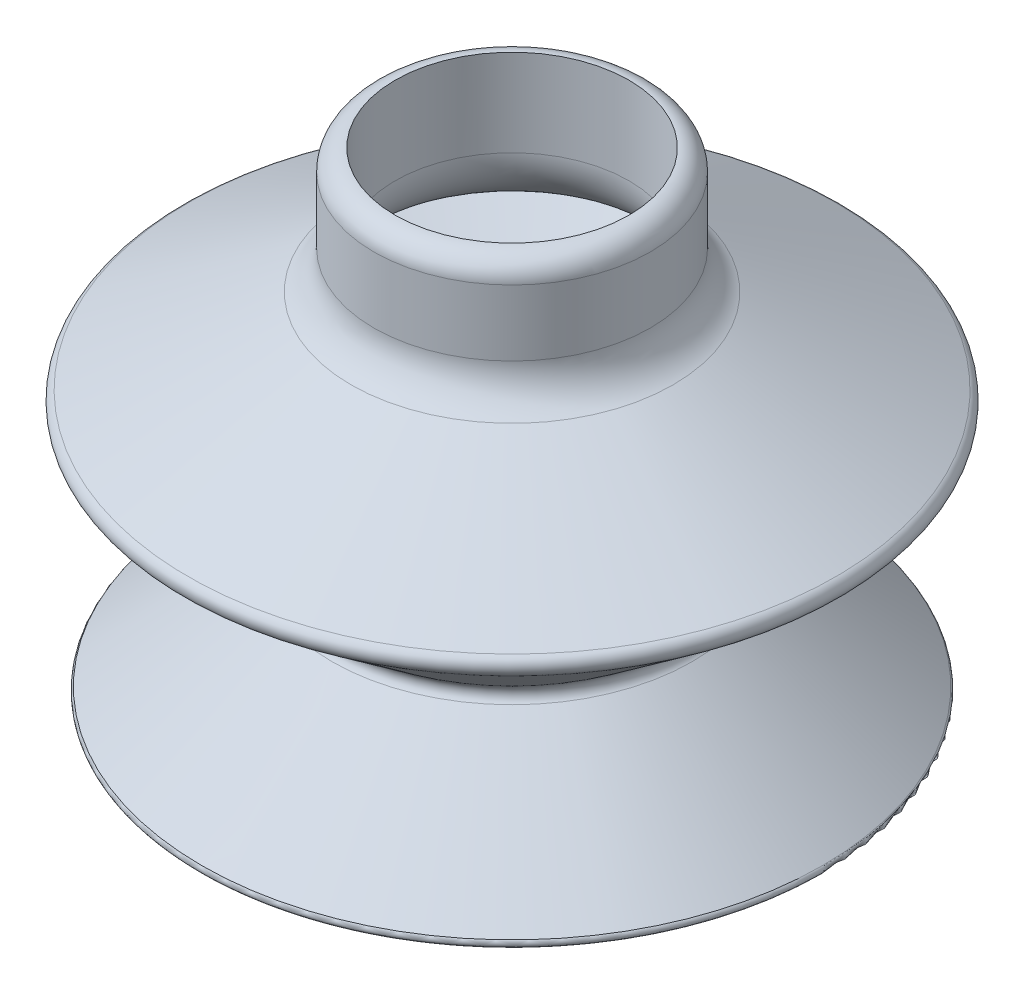
from build123d import *

# Parameters (mm, degrees)
FILLET1_R               = 1
FILLET2_R               = 0.2
BOSS_EXTRUDE1_DEPTH     = 5
FILLET3_R               = 0.5
SKETCH3_R               = 4.35
BOSS_EXTRUDE2_DEPTH     = 6.2
CUT_EXTRUDE1_DEPTH      = 41.03436032
CUT_EXTRUDE1_DEPTH_BACK = 41.03436032
SKETCH4_R               = 1.5
THREAD1_PITCH           = 0.8
BOSS_EXTRUDE3_START     = 1.5
SKETCH6_R               = 5.1
SKETCH6_R_2             = 1.5
BOSS_EXTRUDE3_DEPTH     = 1.5
SKETCH7_R               = 7.576269619
CUT_EXTRUDE2_DEPTH      = 11.2
SKETCH8_R               = 5.5
CUT_EXTRUDE3_DEPTH      = 32.269633931


with BuildPart() as part:
    # Sketch1 → Revolve1 (revolve)
    with BuildSketch(Plane.XY, mode=Mode.PRIVATE) as revolve1_sk:
        with BuildLine():
            Line((13.463409257, 0), (7.817226997, 4.839584794))
            ThreePointArc((7.817226997, 4.839584794), (7.293966035, 6.019159132), (7.880428329, 7.168619714))
            Line((7.880428329, 7.168619714), (14.072950986, 11.919016496))
            Line((14.072950986, 11.919016496), (7.114404428, 15.542569047))
            ThreePointArc((7.114404428, 15.542569047), (5.935162119, 16.647268231), (5.5, 18.203419458))
            Line((5.5, 18.203419458), (5.5, 21.3))
            Line((5.5, 21.3), (0, 21.3))
            Line((0, 21.3), (0, 22.3))
            Line((0, 22.3), (6.5, 22.3))
            Line((6.5, 22.3), (6.5, 18.203419458))
            ThreePointArc((6.5, 18.203419458), (6.790108079, 17.165985306), (7.576269619, 16.429519184))
            Line((7.576269619, 16.429519184), (15.230932595, 12.443475069))
            ThreePointArc((15.230932595, 12.443475069), (15.498103072, 12.043512405), (15.304328576, 11.603283328))
            Line((15.304328576, 11.603283328), (8.489085481, 6.37518637))
            ThreePointArc((8.489085481, 6.37518637), (8.29359805, 5.992032843), (8.46801837, 5.598841397))
            Line((8.46801837, 5.598841397), (15, 0))
            Line((15, 0), (13.463409257, 0))
        make_face()
    revolve(revolve1_sk.sketch.rotate(Axis((0, 0, 0), (0, 1, 0)), 90), axis=Axis((0, 0, 0), (0, 1, 0)))

    # Fillet1
    fillet1_edges = [part.edges().sort_by_distance(p)[0] for p in [
        (0, 22.3, 6.5),
    ]]
    fillet(fillet1_edges, radius=FILLET1_R)

    # Fillet2
    fillet2_edges = [part.edges().sort_by_distance(p)[0] for p in [
        (0, 0, 13.463409257),
        (0, 0, 15),
    ]]
    fillet(fillet2_edges, radius=FILLET2_R)

    # Sketch2 → Boss-Extrude1 (add)
    with BuildSketch(Plane(origin=(0, 22.3, 0), x_dir=(1, 0, 0), z_dir=(0, 1, 0))):
        Polygon((6.5, 0), (3.25, 5.629165125), (-3.25, 5.629165125), (-6.5, 0), (-3.25, -5.629165125), (3.25, -5.629165125), align=None)
    extrude(amount=BOSS_EXTRUDE1_DEPTH)

    # Fillet3
    fillet3_edges = [part.edges().sort_by_distance(p)[0] for p in [
        (4.875, 22.3, 2.814582562),
        (3.25, 24.8, 5.629165125),
        (4.875, 22.3, -2.814582562),
        (6.5, 24.8, 0),
        (0, 22.3, -5.629165125),
        (3.25, 24.8, -5.629165125),
        (-4.875, 22.3, -2.814582562),
        (-3.25, 24.8, -5.629165125),
        (-4.875, 22.3, 2.814582562),
        (-6.5, 24.8, 0),
        (0, 22.3, 5.629165125),
        (-3.25, 24.8, 5.629165125),
        (4.875, 27.3, 2.814582562),
        (4.875, 27.3, -2.814582562),
        (0, 27.3, -5.629165125),
        (-4.875, 27.3, -2.814582562),
        (-4.875, 27.3, 2.814582562),
        (0, 27.3, 5.629165125),
    ]]
    fillet(fillet3_edges, radius=FILLET3_R)

    # Sketch3 → Boss-Extrude2 (add)
    with BuildSketch(Plane(origin=(0, 27.3, 0), x_dir=(1, 0, 0), z_dir=(0, 1, 0))):
        with Locations(Location((0, 0, 0), (0, 0, 270))):
            Circle(SKETCH3_R)
    extrude(amount=BOSS_EXTRUDE2_DEPTH)

    # Sketch4 → Cut-Extrude1 (cut, two sides: drawn at the far end of the back side and taken through both)
    with BuildSketch(Plane(origin=(0, 33.5, 0), x_dir=(1, 0, 0), z_dir=(0, 1, 0)).offset(-CUT_EXTRUDE1_DEPTH_BACK)):
        with Locations(Location((0, 0, 0), (0, 0, 270))):
            Circle(SKETCH4_R)
    extrude(amount=CUT_EXTRUDE1_DEPTH + CUT_EXTRUDE1_DEPTH_BACK, mode=Mode.SUBTRACT)

    # Thread1: the profile of Thread Profile1 profile screwed along a right-hand helix of 13.75 turns, 8 arcs to a turn; built about Z, then put on its axis
    thread1_z = Axis((0, 0, 0), (0, 0, 1))
    thread1_corners = [(4.3497, 0, -0.000173205), (4.7830127, 0, 0.249999999), (4.7830127, 0, 0.349999999), (4.3497, 0, 0.600173203)]
    with BuildLine(mode=Mode.PRIVATE) as thread1_profile:
        Line(thread1_corners[0], thread1_corners[1])
        Line(thread1_corners[1], thread1_corners[2])
        Line(thread1_corners[2], thread1_corners[3])
        Line(thread1_corners[3], thread1_corners[0])
    thread1_cap = Face(thread1_profile.wire())
    thread1_turn_angles = [0, 22.5, 45, 67.5, 90, 112.5, 135, 157.5, 180, 202.5, 225, 247.5, 270, 292.5, 315, 337.5, 360]
    thread1_turn_weights = [1, 0.9238795325112867, 1, 0.9238795325112867, 1, 0.9238795325112867, 1, 0.9238795325112867, 1, 0.9238795325112867, 1, 0.9238795325112867, 1, 0.9238795325112867, 1, 0.9238795325112867, 1]
    thread1_turn_rails = [Edge.make_bspline([Vector(p[0], p[1], 0).rotate(thread1_z, thread1_turn_angles[k]) / thread1_turn_weights[k] + Vector(0, 0, p[2] + THREAD1_PITCH * thread1_turn_angles[k] / 360) for k in range(17)], [0, 0, 0, 1, 1, 2, 2, 3, 3, 4, 4, 5, 5, 6, 6, 7, 7, 8, 8, 8], 2, thread1_turn_weights) for p in thread1_corners]
    thread1_turn_sides = [Face.make_surface_from_curves(thread1_turn_rails[p[0]], thread1_turn_rails[p[1]]) for p in [(0, 1), (1, 2), (2, 3), (3, 0)]]
    thread1_last_angles = [4680, 4702.5, 4725, 4747.5, 4770, 4792.5, 4815, 4837.5, 4860, 4882.5, 4905, 4927.5, 4950]
    thread1_last_weights = [1, 0.9238795325112867, 1, 0.9238795325112867, 1, 0.9238795325112867, 1, 0.9238795325112867, 1, 0.9238795325112867, 1, 0.9238795325112867, 1]
    thread1_last_rails = [Edge.make_bspline([Vector(p[0], p[1], 0).rotate(thread1_z, thread1_last_angles[k]) / thread1_last_weights[k] + Vector(0, 0, p[2] + THREAD1_PITCH * thread1_last_angles[k] / 360) for k in range(13)], [0, 0, 0, 1, 1, 2, 2, 3, 3, 4, 4, 5, 5, 6, 6, 6], 2, thread1_last_weights) for p in thread1_corners]
    thread1_last_sides = [Face.make_surface_from_curves(thread1_last_rails[p[0]], thread1_last_rails[p[1]]) for p in [(0, 1), (1, 2), (2, 3), (3, 0)]]
    thread1 = Plane(origin=(0, 33.5, 0), x_dir=(-1, 0, 0), z_dir=(0, -1, 0)) * Solid(Shell([*[p.moved(Location((0, 0, THREAD1_PITCH * i))) for i in range(13) for p in thread1_turn_sides], *thread1_last_sides, thread1_cap, thread1_cap.rotate(thread1_z, 4950).moved(Location((0, 0, THREAD1_PITCH * 4950 / 360)))]))
    add(thread1)

    # Sketch6 → Boss-Extrude3 (add)
    with BuildSketch(Plane(origin=(0, 27.3, 0), x_dir=(1, 0, 0), z_dir=(0, 1, 0)).offset(BOSS_EXTRUDE3_START)):
        with Locations(Location((0, 0, 0), (0, 0, 270))):
            Circle(SKETCH6_R)
        with Locations(Location((0, 0, 0), (0, 0, 270))):
            Circle(SKETCH6_R_2, mode=Mode.SUBTRACT)
    extrude(amount=-BOSS_EXTRUDE3_DEPTH)

    # Sketch7 → Cut-Extrude2 (cut)
    with BuildSketch(Plane(origin=(0, 33.5, 0), x_dir=(1, 0, 0), z_dir=(0, 1, 0))):
        Circle(SKETCH7_R)
    extrude(amount=-CUT_EXTRUDE2_DEPTH, mode=Mode.SUBTRACT)


with BuildPart() as cut_extrude2_kept_piece:
    # of the separate pieces the step leaves, the one the design keeps (cut_extrude2_pieces_kept)
    add(part.part.solids().sort_by_distance((-1.985362719, 22.3, -5.129165125))[0])

    # Sketch8 → Cut-Extrude3 (cut, through all)
    with BuildSketch(Plane(origin=(0, 22.3, 0), x_dir=(1, 0, 0), z_dir=(0, 1, 0))):
        with Locations(Location((0, 0, 0), (0, 0, 90))):
            Circle(SKETCH8_R)
    extrude(amount=-CUT_EXTRUDE3_DEPTH, mode=Mode.SUBTRACT)


solid = cut_extrude2_kept_piece.part
